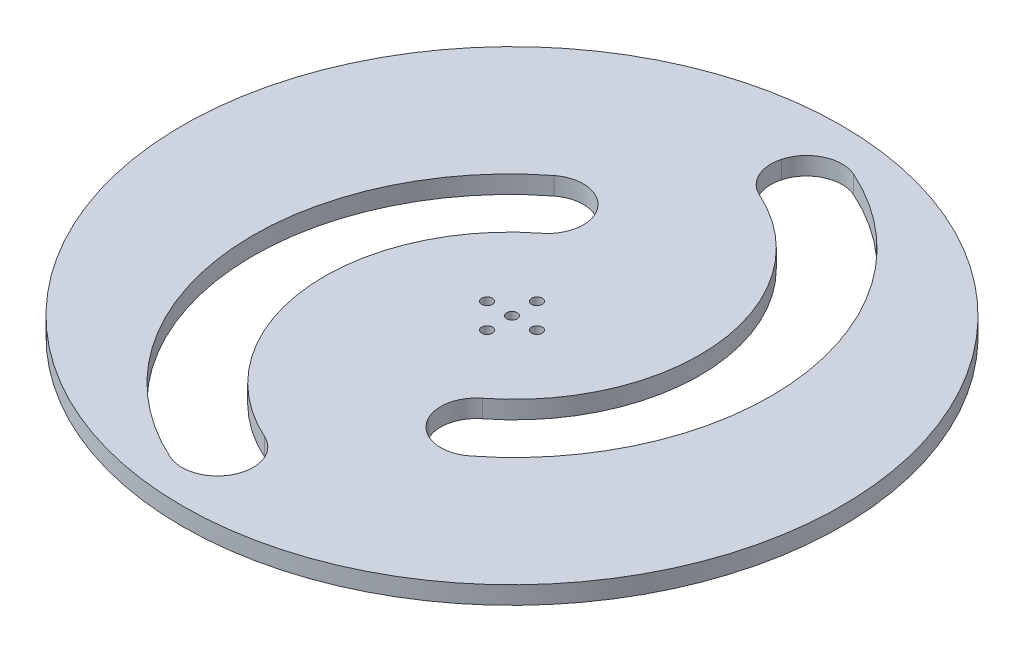
from build123d import *

# Parameters (mm, degrees)
SKETCH_1_R             = 92.5
SKETCH_1_R_2           = 1.5
EXTRUDE_1_DEPTH        = 5
CUT_EXTRUDE_1_DEPTH    = 30
FILLET_3_R             = 10
SKETCH_1_3_R           = 1.5
EXTRUDE_2_DEPTH        = 5
SKETCH_1_5_OUTSIDE_W   = 239.336
SKETCH_1_5_OUTSIDE_H   = 239.336
SKETCH_1_5_OUTSIDE_R   = 92.5
SKETCH_1_5_OUTSIDE_R_2 = 1.5
CUT_EXTRUDE_2_DEPTH    = 5


with BuildPart() as part:
    # 草图1 → 凸台-拉伸1 (new body)
    with BuildSketch(Plane(origin=(0, 0, 0), x_dir=(1, 0, 0), z_dir=(0, 1, 0))):
        with Locations(Location((0, 0, 0), (0, 0, 270))):
            Circle(SKETCH_1_R)
        with Locations(Location((0, 0, 0), (0, 0, 270))):
            Circle(SKETCH_1_R_2, mode=Mode.SUBTRACT)
        with Locations(Location((0, 7, 0), (0, 0, 270))):
            Circle(SKETCH_1_R_2, mode=Mode.SUBTRACT)
        with Locations(Location((7, 0, 0), (0, 0, 270))):
            Circle(SKETCH_1_R_2, mode=Mode.SUBTRACT)
        with Locations(Location((0, -7, 0), (0, 0, 270))):
            Circle(SKETCH_1_R_2, mode=Mode.SUBTRACT)
        with Locations(Location((-7, 0, 0), (0, 0, 270))):
            Circle(SKETCH_1_R_2, mode=Mode.SUBTRACT)
    extrude(amount=EXTRUDE_1_DEPTH)

    # 草图2 → 切除-拉伸1 (cut)
    with BuildSketch(Plane(origin=(0, 5, 0), x_dir=(1, 0, 0), z_dir=(0, 1, 0))):
        with BuildLine():
            Line((2.591280941, 86.258429639), (-2.591280941, 66.941570361))
            ThreePointArc((-2.591280941, 66.941570361), (35.5302713, 22.943474897), (8.881266501, -28.814767857))
            Line((8.881266501, -28.814767857), (18.480344966, -46.360641806))
            ThreePointArc((18.480344966, -46.360641806), (55.388254532, 25.322655836), (2.591280941, 86.258429639))
        make_face()
        with BuildLine():
            Line((-8.881266501, 28.814767857), (-18.480344966, 46.360641806))
            ThreePointArc((-18.480344966, 46.360641806), (-55.388254532, -25.322655836), (-2.591280941, -86.258429639))
            Line((-2.591280941, -86.258429639), (2.591280941, -66.941570361))
            ThreePointArc((2.591280941, -66.941570361), (-35.5302713, -22.943474897), (-8.881266501, 28.814767857))
        make_face()
    extrude(amount=-CUT_EXTRUDE_1_DEPTH, mode=Mode.SUBTRACT)

    # 圆角3
    fillet_3_edges = [part.edges().sort_by_distance(p)[0] for p in [
        (-18.480344966, 2.5, -46.360641806),
        (-8.881266501, 2.5, -28.814767857),
        (-2.591280941, 2.5, 86.258429639),
        (2.591280941, 2.5, 66.941570361),
        (18.480344966, 2.5, 46.360641806),
        (8.881266501, 2.5, 28.814767857),
        (-2.591280941, 2.5, -66.941570361),
        (2.591280941, 2.5, -86.258429639),
    ]]
    fillet(fillet_3_edges, radius=FILLET_3_R - 0.0001)  # a hair under: the kernel refuses the full size

    # 草图1<3> → 凸台-拉伸2 (add)
    with BuildSketch(Plane(origin=(0, 0, 0), x_dir=(1, 0, 0), z_dir=(0, 1, 0))):
        Circle(SKETCH_1_3_R)
    extrude(amount=EXTRUDE_2_DEPTH)

    # 草图1<5> outside → 切除-拉伸2 (cut)
    # profile 1 of 6: a face of its own
    with BuildSketch(Plane(origin=(0, 0, 0), x_dir=(1, 0, 0), z_dir=(0, 1, 0))):
        Rectangle(SKETCH_1_5_OUTSIDE_W, SKETCH_1_5_OUTSIDE_H)
        with Locations(Location((0, 0, 0), (0, 0, 270))):
            Circle(SKETCH_1_5_OUTSIDE_R, mode=Mode.SUBTRACT)
    # profile 2 of 6: a face of its own
    with BuildSketch(Plane(origin=(0, 0, 0), x_dir=(1, 0, 0), z_dir=(0, 1, 0))):
        with Locations(Location((0, 0, 0), (0, 0, 270))):
            Circle(SKETCH_1_5_OUTSIDE_R_2)
    # profile 3 of 6: a face of its own
    with BuildSketch(Plane(origin=(0, 0, 0), x_dir=(1, 0, 0), z_dir=(0, 1, 0))):
        with Locations(Location((0, 7, 0), (0, 0, 270))):
            Circle(SKETCH_1_5_OUTSIDE_R_2)
    # profile 4 of 6: a face of its own
    with BuildSketch(Plane(origin=(0, 0, 0), x_dir=(1, 0, 0), z_dir=(0, 1, 0))):
        with Locations(Location((7, 0, 0), (0, 0, 270))):
            Circle(SKETCH_1_5_OUTSIDE_R_2)
    # profile 5 of 6: a face of its own
    with BuildSketch(Plane(origin=(0, 0, 0), x_dir=(1, 0, 0), z_dir=(0, 1, 0))):
        with Locations(Location((0, -7, 0), (0, 0, 270))):
            Circle(SKETCH_1_5_OUTSIDE_R_2)
    # profile 6 of 6: a face of its own
    with BuildSketch(Plane(origin=(0, 0, 0), x_dir=(1, 0, 0), z_dir=(0, 1, 0))):
        with Locations(Location((-7, 0, 0), (0, 0, 270))):
            Circle(SKETCH_1_5_OUTSIDE_R_2)
    extrude(amount=CUT_EXTRUDE_2_DEPTH, mode=Mode.SUBTRACT)


solid = part.part
